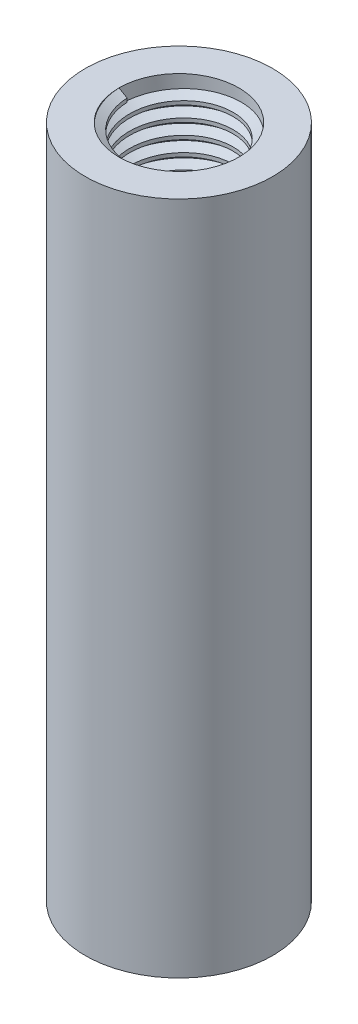
from build123d import *
from build123d.topology import SkipClean

# Parameters (mm, degrees)
SKETCH1_R           = 12.5
BOSS_EXTRUDE1_DEPTH = 90
SKETCH2_R           = 8
CUT_EXTRUDE1_DEPTH  = 50
THREAD1_PITCH       = 2
SKETCH11_R          = 2.25
CUT_EXTRUDE2_DEPTH  = 15
THREAD2_PITCH       = 0.7


with BuildPart() as part:
    # Sketch1 → Boss-Extrude1 (new body)
    with BuildSketch(Plane(origin=(0, 0, 0), x_dir=(1, 0, 0), z_dir=(0, 1, 0))):
        with Locations(Location((0, 0, 0), (0, 0, 90))):
            Circle(SKETCH1_R)
    extrude(amount=BOSS_EXTRUDE1_DEPTH)

    # Sketch2 → Cut-Extrude1 (cut)
    with BuildSketch(Plane(origin=(0, 90, 0), x_dir=(1, 0, 0), z_dir=(0, 1, 0))):
        with Locations(Location((0, 0, 0), (0, 0, 270))):
            Circle(SKETCH2_R)
    extrude(amount=-CUT_EXTRUDE1_DEPTH, mode=Mode.SUBTRACT)

    # Thread1: the profile of Thread Profile1 profile screwed along a left-hand helix of 17.5 turns, 10 arcs to a turn; built about Z, then put on its axis
    with SkipClean():  # the faces are left unmerged after this step: merging them gives an invalid solid
        thread1_z = Axis((0, 0, 0), (0, 0, 1))
        thread1_corners = [(8.0003, 0, -0.000173205), (8.0003, 0, 1.7501732), (6.91746825, 0, 1.124999997), (6.91746825, 0, 0.624999997)]
        with BuildLine(mode=Mode.PRIVATE) as thread1_profile:
            Line(thread1_corners[0], thread1_corners[1])
            Line(thread1_corners[1], thread1_corners[2])
            Line(thread1_corners[2], thread1_corners[3])
            Line(thread1_corners[3], thread1_corners[0])
        thread1_cap = Face(thread1_profile.wire())
        thread1_turn_angles = [0, -18, -36, -54, -72, -90, -108, -126, -144, -162, -180, -198, -216, -234, -252, -270, -288, -306, -324, -342, -360]
        thread1_turn_weights = [1, 0.9510565162951535, 1, 0.9510565162951535, 1, 0.9510565162951535, 1, 0.9510565162951535, 1, 0.9510565162951535, 1, 0.9510565162951535, 1, 0.9510565162951535, 1, 0.9510565162951535, 1, 0.9510565162951535, 1, 0.9510565162951535, 1]
        thread1_turn_rails = [Edge.make_bspline([Vector(p[0], p[1], 0).rotate(thread1_z, thread1_turn_angles[k]) / thread1_turn_weights[k] + Vector(0, 0, p[2] + -THREAD1_PITCH * thread1_turn_angles[k] / 360) for k in range(21)], [0, 0, 0, 1, 1, 2, 2, 3, 3, 4, 4, 5, 5, 6, 6, 7, 7, 8, 8, 9, 9, 10, 10, 10], 2, thread1_turn_weights) for p in thread1_corners]
        thread1_turn_sides = [Face.make_surface_from_curves(thread1_turn_rails[p[0]], thread1_turn_rails[p[1]]) for p in [(0, 1), (1, 2), (2, 3), (3, 0)]]
        thread1_last_angles = [-6120, -6138, -6156, -6174, -6192, -6210, -6228, -6246, -6264, -6282, -6300]
        thread1_last_weights = [1, 0.9510565162951535, 1, 0.9510565162951535, 1, 0.9510565162951535, 1, 0.9510565162951535, 1, 0.9510565162951535, 1]
        thread1_last_rails = [Edge.make_bspline([Vector(p[0], p[1], 0).rotate(thread1_z, thread1_last_angles[k]) / thread1_last_weights[k] + Vector(0, 0, p[2] + -THREAD1_PITCH * thread1_last_angles[k] / 360) for k in range(11)], [0, 0, 0, 1, 1, 2, 2, 3, 3, 4, 4, 5, 5, 5], 2, thread1_last_weights) for p in thread1_corners]
        thread1_last_sides = [Face.make_surface_from_curves(thread1_last_rails[p[0]], thread1_last_rails[p[1]]) for p in [(0, 1), (1, 2), (2, 3), (3, 0)]]
        thread1 = Plane(origin=(0, 90, 0), x_dir=(-1, 0, 0), z_dir=(0, -1, 0)) * Solid(Shell([*[p.moved(Location((0, 0, THREAD1_PITCH * i))) for i in range(17) for p in thread1_turn_sides], *thread1_last_sides, thread1_cap, thread1_cap.rotate(thread1_z, -6300).moved(Location((0, 0, -THREAD1_PITCH * -6300 / 360)))]))
        add(thread1)

    # Sketch11 → Cut-Extrude2 (cut)
    with SkipClean():  # the faces are left unmerged after this step: merging them gives an invalid solid
        with BuildSketch(Plane(origin=(0, 40, 0), x_dir=(1, 0, 0), z_dir=(0, 1, 0))):
            with Locations(Location((0, 0, 0), (0, 0, 270))):
                Circle(SKETCH11_R)
        extrude(amount=-CUT_EXTRUDE2_DEPTH, mode=Mode.SUBTRACT)

    # Thread2: the profile of Thread Profile2 profile screwed along a right-hand helix of 14.285714 turns, 6 arcs to a turn; built about Z, then put on its axis
    with SkipClean():  # the faces are left unmerged after this step: merging them gives an invalid solid
        thread2_z = Axis((0, 0, 0), (0, 0, 1))
        thread2_corners = [(2.2503, 0, -0.000173205), (2.2503, 0, 0.612673203), (1.871113887, 0, 0.393749999), (1.871113887, 0, 0.218749999)]
        with BuildLine(mode=Mode.PRIVATE) as thread2_profile:
            Line(thread2_corners[0], thread2_corners[1])
            Line(thread2_corners[1], thread2_corners[2])
            Line(thread2_corners[2], thread2_corners[3])
            Line(thread2_corners[3], thread2_corners[0])
        thread2_cap = Face(thread2_profile.wire())
        thread2_turn_angles = [0, 30, 60, 90, 120, 150, 180, 210, 240, 270, 300, 330, 360]
        thread2_turn_weights = [1, 0.8660254037844387, 1, 0.8660254037844387, 1, 0.8660254037844387, 1, 0.8660254037844387, 1, 0.8660254037844387, 1, 0.8660254037844387, 1]
        thread2_turn_rails = [Edge.make_bspline([Vector(p[0], p[1], 0).rotate(thread2_z, thread2_turn_angles[k]) / thread2_turn_weights[k] + Vector(0, 0, p[2] + THREAD2_PITCH * thread2_turn_angles[k] / 360) for k in range(13)], [0, 0, 0, 1, 1, 2, 2, 3, 3, 4, 4, 5, 5, 6, 6, 6], 2, thread2_turn_weights) for p in thread2_corners]
        thread2_turn_sides = [Face.make_surface_from_curves(thread2_turn_rails[p[0]], thread2_turn_rails[p[1]]) for p in [(0, 1), (1, 2), (2, 3), (3, 0)]]
        thread2_last_angles = [5040, 5070, 5100, 5121.428571429, 5142.857142857]
        thread2_last_weights = [1, 0.8660254037844387, 1, 0.9308737486442035, 1]
        thread2_last_rails = [Edge.make_bspline([Vector(p[0], p[1], 0).rotate(thread2_z, thread2_last_angles[k]) / thread2_last_weights[k] + Vector(0, 0, p[2] + THREAD2_PITCH * thread2_last_angles[k] / 360) for k in range(5)], [0, 0, 0, 1, 1, 2, 2, 2], 2, thread2_last_weights) for p in thread2_corners]
        thread2_last_sides = [Face.make_surface_from_curves(thread2_last_rails[p[0]], thread2_last_rails[p[1]]) for p in [(0, 1), (1, 2), (2, 3), (3, 0)]]
        thread2 = Plane(origin=(0, 40, 0), x_dir=(-1, 0, 0), z_dir=(0, -1, 0)) * Solid(Shell([*[p.moved(Location((0, 0, THREAD2_PITCH * i))) for i in range(14) for p in thread2_turn_sides], *thread2_last_sides, thread2_cap, thread2_cap.rotate(thread2_z, 5142.857142857).moved(Location((0, 0, THREAD2_PITCH * 5142.857142857 / 360)))]))
        add(thread2)


solid = part.part
